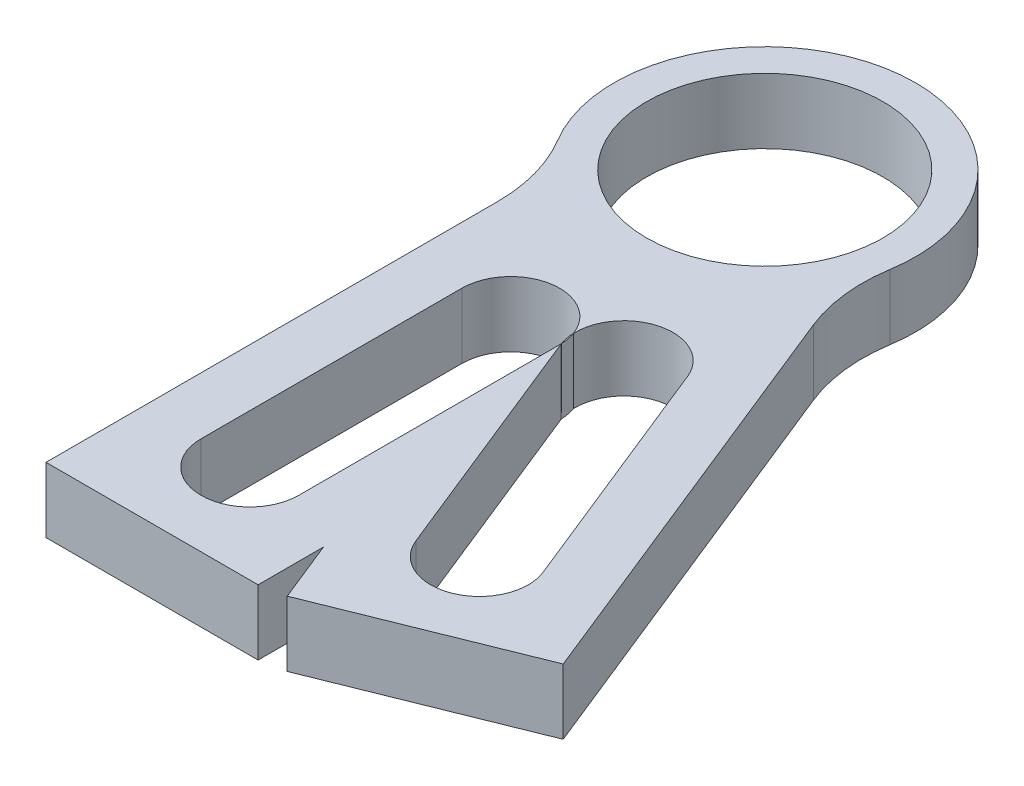
from build123d import *

# Parameters (mm, degrees)
SKETCH1_R           = 11.5062
BOSS_EXTRUDE1_DEPTH = 6.35
FILLET2_R           = 15.875
CUT_EXTRUDE1_DEPTH  = 6.35


with BuildPart() as part:
    # Sketch1 → Boss-Extrude1 (new body)
    with BuildSketch(Plane(origin=(0, 0, 0), x_dir=(1, 0, 0), z_dir=(0, 1, 0))):
        with BuildLine():
            Line((-10.3251, -10.436950868), (-10.3251, -59.659625888))
            Line((-10.3251, -59.659625888), (10.3251, -59.659625888))
            Line((10.3251, -59.659625888), (10.3251, -53.291818362))
            Line((10.3251, -53.291818362), (12.70330764, -59.198856594))
            Line((12.70330764, -59.198856594), (31.859276324, -51.486553188))
            Line((31.859276324, -51.486553188), (13.475909385, -5.825590071))
            ThreePointArc((13.475909385, -5.825590071), (-2.792501038, 14.413173537), (-10.3251, -10.436950868))
        make_face()
        Circle(SKETCH1_R, mode=Mode.SUBTRACT)
    extrude(amount=BOSS_EXTRUDE1_DEPTH)

    # Fillet2
    fillet2_edges = [part.edges().sort_by_distance(p)[0] for p in [
        (13.475909385, 3.175, 5.825590071),
        (-10.3251, 3.175, 10.436950868),
    ]]
    fillet(fillet2_edges, radius=FILLET2_R)

    # Sketch2 → Cut-Extrude1 (cut)
    with BuildSketch(Plane(origin=(0, 6.35, 0), x_dir=(1, 0, 0), z_dir=(0, 1, 0))):
        with BuildLine():
            Line((-4.7625, -24.734625888), (-4.7625, -50.134625888))
            ThreePointArc((-4.7625, -50.134625888), (0, -54.897125888), (4.7625, -50.134625888))
            Line((4.7625, -50.134625888), (4.7625, -24.734625888))
            ThreePointArc((4.7625, -24.734625888), (4.761751418, -24.650188435), (4.759505907, -24.565777526))
            ThreePointArc((4.759505907, -24.565777526), (4.561776408, -23.850092709), (4.477689172, -23.112372538))
            ThreePointArc((4.477689172, -23.112372538), (-0.823532504, -20.04386897), (-4.7625, -24.734625888))
        make_face()
        with BuildLine():
            ThreePointArc((13.655084536, -21.164856417), (8.248569665, -18.284766184), (4.477689172, -23.112372538))
            ThreePointArc((4.477689172, -23.112372538), (4.675418671, -23.828057356), (4.759505907, -24.565777526))
            ThreePointArc((4.759505907, -24.565777526), (4.788718244, -24.644247582), (4.819305623, -24.722191937))
            Line((4.819305623, -24.722191937), (14.305533675, -48.284269038))
            ThreePointArc((14.305533675, -48.284269038), (20.502090891, -50.923490735), (23.141312588, -44.726933519))
            Line((23.141312588, -44.726933519), (13.655084536, -21.164856417))
        make_face()
    extrude(amount=-CUT_EXTRUDE1_DEPTH, mode=Mode.SUBTRACT)


solid = part.part
